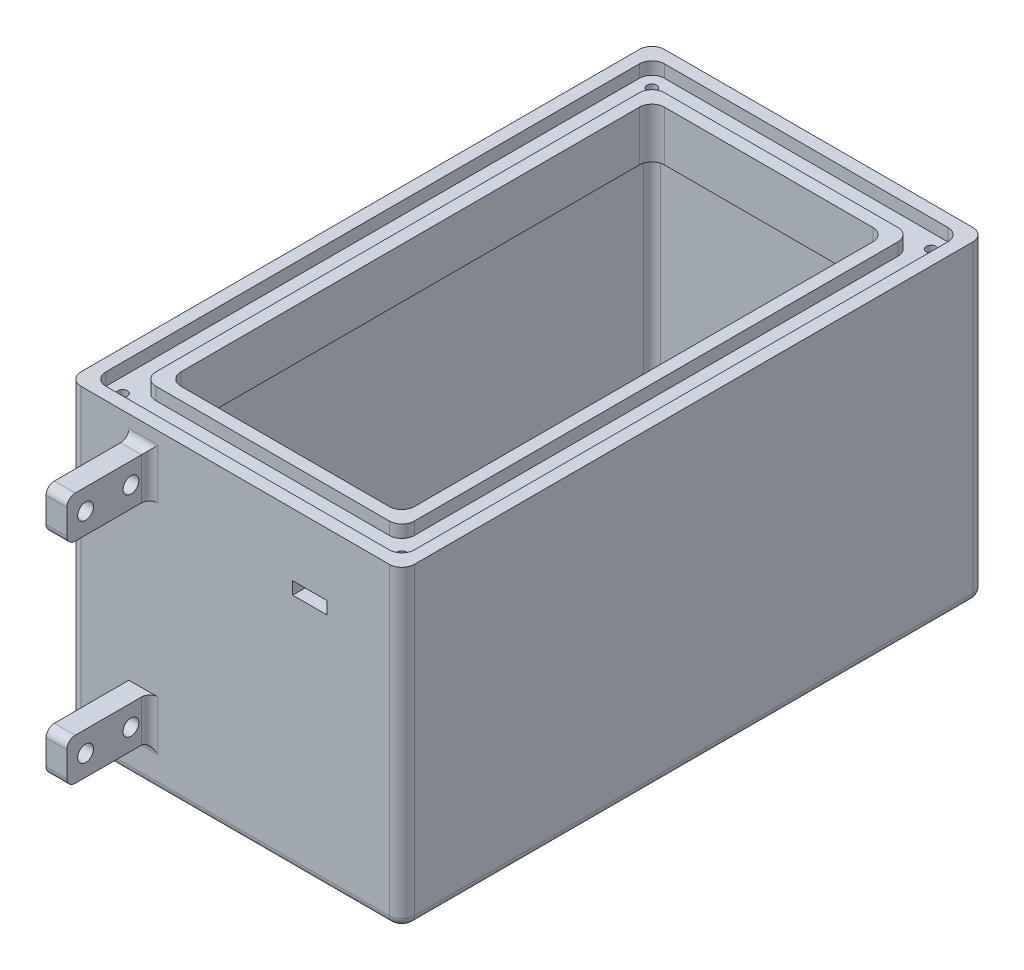
from build123d import *

# Parameters (mm, degrees)
SKETCH1_W           = 80
SKETCH1_H           = 140
BOSS_EXTRUDE1_DEPTH = 3
SKETCH2_W           = 80
SKETCH2_H           = 140
SKETCH2_W_2         = 74
SKETCH2_H_2         = 134
BOSS_EXTRUDE2_DEPTH = 60
FILLET1_R           = 2
FILLET2_R           = 2
SKETCH6_W           = 80
SKETCH6_H           = 140
BOSS_EXTRUDE3_DEPTH = 12
CUT_EXTRUDE1_DEPTH  = 3
SKETCH8_R           = 1.15
CUT_EXTRUDE2_DEPTH  = 6
FILLET3_R           = 3
SKETCH9_W           = 5
SKETCH9_H           = 30
BOSS_EXTRUDE4_DEPTH = 15
SKETCH10_W          = 5
SKETCH10_H          = 30
BOSS_EXTRUDE5_DEPTH = 53
FILLET4_R           = 3
FILLET5_R           = 3
SKETCH12_W          = 5
SKETCH12_H          = 10
BOSS_EXTRUDE6_DEPTH = 19.88
FILLET6_R           = 2
FILLET7_R           = 2
SKETCH13_R          = 1.9
CUT_EXTRUDE3_DEPTH  = 172.800029104
SKETCH14_W          = 8.2
SKETCH14_H          = 3
CUT_EXTRUDE4_DEPTH  = 3
BOSS_EXTRUDE7_DEPTH = 1.35
SKETCH16_W          = 5
SKETCH16_H          = 2.7
CUT_EXTRUDE5_DEPTH  = 3


with BuildPart() as part:
    # Sketch1 → Boss-Extrude1 (new body)
    with BuildSketch(Plane(origin=(0, 0, 0), x_dir=(1, 0, 0), z_dir=(0, 1, 0))):
        with Locations((40, 70)):
            Rectangle(SKETCH1_W, SKETCH1_H)
    extrude(amount=BOSS_EXTRUDE1_DEPTH)

    # Sketch2 → Boss-Extrude2 (add)
    with BuildSketch(Plane(origin=(0, 3, 0), x_dir=(1, 0, 0), z_dir=(0, 1, 0))):
        with Locations((40, 70)):
            Rectangle(SKETCH2_W, SKETCH2_H)
        with Locations((40, 70)):
            Rectangle(SKETCH2_W_2, SKETCH2_H_2, mode=Mode.SUBTRACT)
    extrude(amount=BOSS_EXTRUDE2_DEPTH)

    # Fillet1
    fillet1_edges = [part.edges().sort_by_distance(p)[0] for p in [
        (3, 3, -70),
        (40, 3, -3),
        (77, 3, -70),
        (40, 3, -137),
        (3, 33, -3),
        (77, 33, -3),
        (77, 33, -137),
        (3, 33, -137),
    ]]
    fillet(fillet1_edges, radius=FILLET1_R)

    # Fillet2
    fillet2_edges = [part.edges().sort_by_distance(p)[0] for p in [
        (40, 0, -140),
        (80, 0, -70),
        (40, 0, 0),
        (0, 0, -70),
    ]]
    fillet(fillet2_edges, radius=FILLET2_R)

    # Sketch6 → Boss-Extrude3 (add)
    with BuildSketch(Plane(origin=(0, 63, 0), x_dir=(1, 0, 0), z_dir=(0, 1, 0))):
        with Locations((40, 70)):
            Rectangle(SKETCH6_W, SKETCH6_H)
        with BuildLine():
            Line((15, 128), (65, 128))
            ThreePointArc((65, 128), (67.121320344, 127.121320344), (68, 125))
            Line((68, 125), (68, 15))
            ThreePointArc((68, 15), (67.121320344, 12.878679656), (65, 12))
            Line((65, 12), (15, 12))
            ThreePointArc((15, 12), (12.878679656, 12.878679656), (12, 15))
            Line((12, 15), (12, 125))
            ThreePointArc((12, 125), (12.878679656, 127.121320344), (15, 128))
        make_face(mode=Mode.SUBTRACT)
    extrude(amount=BOSS_EXTRUDE3_DEPTH)

    # Sketch7 → Cut-Extrude1 (cut)
    with BuildSketch(Plane(origin=(0, 75, 0), x_dir=(1, 0, 0), z_dir=(0, 1, 0))):
        with BuildLine():
            Line((6, 137), (74, 137))
            ThreePointArc((74, 137), (76.121320344, 136.121320344), (77, 134))
            Line((77, 134), (77, 6))
            ThreePointArc((77, 6), (76.121320344, 3.878679656), (74, 3))
            Line((74, 3), (6, 3))
            ThreePointArc((6, 3), (3.878679656, 3.878679656), (3, 6))
            Line((3, 6), (3, 134))
            ThreePointArc((3, 134), (3.878679656, 136.121320344), (6, 137))
        make_face()
        with BuildLine():
            Line((12, 131), (68, 131))
            ThreePointArc((68, 131), (70.121320344, 130.121320344), (71, 128))
            Line((71, 128), (71, 12))
            ThreePointArc((71, 12), (70.121320344, 9.878679656), (68, 9))
            Line((68, 9), (12, 9))
            ThreePointArc((12, 9), (9.878679656, 9.878679656), (9, 12))
            Line((9, 12), (9, 128))
            ThreePointArc((9, 128), (9.878679656, 130.121320344), (12, 131))
        make_face(mode=Mode.SUBTRACT)
    extrude(amount=-CUT_EXTRUDE1_DEPTH, mode=Mode.SUBTRACT)

    # Sketch8 → Cut-Extrude2 (cut)
    with BuildSketch(Plane(origin=(0, 72, 0), x_dir=(1, 0, 0), z_dir=(0, 1, 0))):
        with Locations(Location((6.5, 6.5, 0), (0, 0, 270))):
            Circle(SKETCH8_R)
        with Locations(Location((73.5, 6.5, 0), (0, 0, 270))):
            Circle(SKETCH8_R)
        with Locations(Location((73.5, 133.5, 0), (0, 0, 270))):
            Circle(SKETCH8_R)
        with Locations(Location((6.5, 133.5, 0), (0, 0, 270))):
            Circle(SKETCH8_R)
    extrude(amount=-CUT_EXTRUDE2_DEPTH, mode=Mode.SUBTRACT)

    # Fillet3
    # the kernel refuses this fillet: 3 mm, written as the material it takes off along each edge
    with BuildSketch(Plane(origin=(77, 0, -3), x_dir=(1, 0, 0), z_dir=(0, 0, -1))) as fillet3_piece_1:
        with BuildLine():
            CenterArc((1, -2), 2, 0, 90)
            Line((3, -2), (3, 0))
            Line((3, 0), (1, 0))
        make_face()
    revolve(axis=Axis((77, 0, -3), (0, -1, 0)), revolution_arc=90, mode=Mode.SUBTRACT)
    with BuildSketch(Plane(origin=(3, 0, -3), x_dir=(0, 0, 1), z_dir=(1, 0, 0))) as fillet3_piece_2:
        with BuildLine():
            CenterArc((1, -2), 2, 0, 90)
            Line((3, -2), (3, 0))
            Line((3, 0), (1, 0))
        make_face()
    revolve(axis=Axis((3, 0, -3), (0, -1, 0)), revolution_arc=90, mode=Mode.SUBTRACT)
    with BuildSketch(Plane(origin=(77, 0, -137), x_dir=(0, 0, -1), z_dir=(-1, 0, 0))) as fillet3_piece_3:
        with BuildLine():
            CenterArc((1, -2), 2, 0, 90)
            Line((3, -2), (3, 0))
            Line((3, 0), (1, 0))
        make_face()
    revolve(axis=Axis((77, 0, -137), (0, -1, 0)), revolution_arc=90, mode=Mode.SUBTRACT)
    with BuildSketch(Plane(origin=(3, 0, -137), x_dir=(-1, 0, 0), z_dir=(0, 0, 1))) as fillet3_piece_4:
        with BuildLine():
            CenterArc((1, -2), 2, 0, 90)
            Line((3, -2), (3, 0))
            Line((3, 0), (1, 0))
        make_face()
    revolve(axis=Axis((3, 0, -137), (0, -1, 0)), revolution_arc=90, mode=Mode.SUBTRACT)
    with BuildSketch(Plane(origin=(0, 0, -140), x_dir=(1, 0, 0), z_dir=(0, 1, 0)), Plane(origin=(80, 82.5, -140), x_dir=(-1, 0, 0), z_dir=(0, -1, 0)), Plane(origin=(80, 82.5, 0), x_dir=(0, 0, -1), z_dir=(0, -1, 0)), Plane(origin=(0, 0, 0), x_dir=(0, 0, -1), z_dir=(0, 1, 0))) as fillet3_piece_5:
        with BuildLine():
            CenterArc((FILLET3_R, -FILLET3_R), FILLET3_R, 90, 90)
            Line((0, -FILLET3_R), (0, 0))
            Line((0, 0), (FILLET3_R, 0))
        make_face()
    extrude(amount=82.5, mode=Mode.SUBTRACT)

    # Sketch9 → Boss-Extrude4 (add)
    with BuildSketch(Plane.ZY):
        with Locations((-84.5, 40)):
            Rectangle(SKETCH9_W, SKETCH9_H)
    extrude(amount=BOSS_EXTRUDE4_DEPTH)

    # Sketch10 → Boss-Extrude5 (add)
    with BuildSketch(Plane(origin=(0, 0, -87), x_dir=(-1, 0, 0), z_dir=(0, 0, -1))):
        with Locations((12.5, 40)):
            Rectangle(SKETCH10_W, SKETCH10_H)
    extrude(amount=BOSS_EXTRUDE5_DEPTH)

    # Fillet4
    fillet4_edges = [part.edges().sort_by_distance(p)[0] for p in [
        (0, 40, -87),
        (0, 25, -84.5),
        (0, 40, -82),
        (0, 55, -84.5),
    ]]
    fillet(fillet4_edges, radius=FILLET4_R)

    # Fillet5
    fillet5_edges = [part.edges().sort_by_distance(p)[0] for p in [
        (-15, 40, -82),
        (-10, 40, -87),
        (-12.5, 55, -140),
        (-12.5, 25, -140),
    ]]
    fillet(fillet5_edges, radius=FILLET5_R)

    # Sketch12 → Boss-Extrude6 (add)
    with BuildSketch(Plane.XY):
        with Locations((17, 65)):
            Rectangle(SKETCH12_W, SKETCH12_H)
        with Locations((17, 14.67)):
            Rectangle(SKETCH12_W, SKETCH12_H)
    extrude(amount=BOSS_EXTRUDE6_DEPTH)

    # Fillet6
    fillet6_edges = [part.edges().sort_by_distance(p)[0] for p in [
        (19.5, 65, 0),
        (17, 70, 0),
        (17, 9.67, 0),
        (19.5, 14.67, 0),
    ]]
    fillet(fillet6_edges, radius=FILLET6_R)

    # Fillet7
    fillet7_edges = [part.edges().sort_by_distance(p)[0] for p in [
        (17, 60, 19.88),
        (17, 70, 19.88),
        (17, 9.67, 19.88),
        (17, 19.67, 19.88),
    ]]
    fillet(fillet7_edges, radius=FILLET7_R)

    # Sketch13 → Cut-Extrude3 (cut, through all)
    with BuildSketch(Plane.ZY.offset(-14.5)):
        with Locations(Location((4.5, 65, 0), (0, 0, 270))):
            Circle(SKETCH13_R)
        with Locations(Location((15.38, 65, 0), (0, 0, 270))):
            Circle(SKETCH13_R)
        with Locations(Location((4.5, 14.67, 0), (0, 0, 270))):
            Circle(SKETCH13_R)
        with Locations(Location((15.38, 14.67, 0), (0, 0, 270))):
            Circle(SKETCH13_R)
    extrude(amount=-CUT_EXTRUDE3_DEPTH, mode=Mode.SUBTRACT)

    # Sketch14 → Cut-Extrude4 (cut)
    with BuildSketch(Plane.XY):
        with Locations((57.9, 58.5)):
            Rectangle(SKETCH14_W, SKETCH14_H)
    extrude(amount=-CUT_EXTRUDE4_DEPTH, mode=Mode.SUBTRACT)

    # Sketch15 → Boss-Extrude7 (add)
    with BuildSketch(Plane.XZ):
        with BuildLine():
            Line((19.25, -42.75), (60.75, -42.75))
            ThreePointArc((60.75, -42.75), (61.810660172, -43.189339828), (62.25, -44.25))
            Line((62.25, -44.25), (62.25, -95.75))
            ThreePointArc((62.25, -95.75), (61.810660172, -96.810660172), (60.75, -97.25))
            Line((60.75, -97.25), (19.25, -97.25))
            ThreePointArc((19.25, -97.25), (18.189339828, -96.810660172), (17.75, -95.75))
            Line((17.75, -95.75), (17.75, -44.25))
            ThreePointArc((17.75, -44.25), (18.189339828, -43.189339828), (19.25, -42.75))
        make_face()
        with BuildLine():
            Line((21.25, -44.75), (58.75, -44.75))
            ThreePointArc((58.75, -44.75), (59.810660172, -45.189339828), (60.25, -46.25))
            Line((60.25, -46.25), (60.25, -93.75))
            ThreePointArc((60.25, -93.75), (59.810660172, -94.810660172), (58.75, -95.25))
            Line((58.75, -95.25), (21.25, -95.25))
            ThreePointArc((21.25, -95.25), (20.189339828, -94.810660172), (19.75, -93.75))
            Line((19.75, -93.75), (19.75, -46.25))
            ThreePointArc((19.75, -46.25), (20.189339828, -45.189339828), (21.25, -44.75))
        make_face(mode=Mode.SUBTRACT)
    extrude(amount=BOSS_EXTRUDE7_DEPTH)

    # Sketch16 → Cut-Extrude5 (cut)
    with BuildSketch(Plane.XZ):
        with Locations((40, -48.03)):
            Rectangle(SKETCH16_W, SKETCH16_H)
    extrude(amount=-CUT_EXTRUDE5_DEPTH, mode=Mode.SUBTRACT)


solid = part.part
